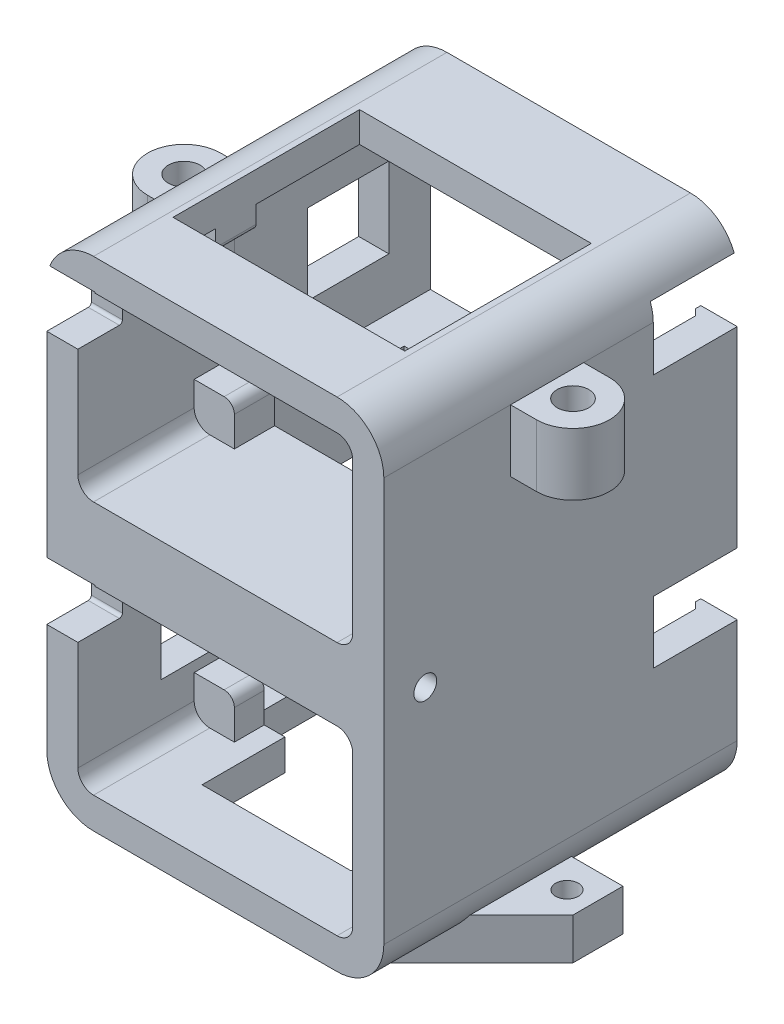
from build123d import *

# Parameters (mm, degrees)
EXTRUDE_2_DEPTH      = 11.22
EXTRUDE_3_DEPTH      = 3.88
CUT_EXTRUDE_1_DEPTH  = 4.65
SKETCH_8_R           = 3.525
SKETCH_8_R_2         = 1.525
EXTRUDE_5_DEPTH      = 6
SKETCH_9_W           = 22.36
SKETCH_9_H           = 3
CUT_EXTRUDE_3_DEPTH  = 8
SKETCH_10_W          = 21.46
SKETCH_10_H          = 6.88
CUT_EXTRUDE_4_DEPTH  = 1
CUT_EXTRUDE_5_DEPTH  = 8
EXTRUDE_7_DEPTH      = 3
SKETCH_15_W          = 26.7
SKETCH_15_H          = 42.2
EXTRUDE_18257_DEPTH  = 19
SKETCH_16_W          = 26.7
SKETCH_16_H          = 6.8
EXTRUDE_9_DEPTH      = 16
EXTRUDE_19749_DEPTH  = 4
CUT_EXTRUDE_8_REACH  = 51.099
SKETCH_17_W          = 19.76
SKETCH_17_H          = 10
CUT_EXTRUDE_9_REACH  = 63.216
SKETCH_18_W          = 8.1
SKETCH_18_H          = 6
CUT_EXTRUDE_START    = -2.91
SKETCH_19_W          = 21.46
SKETCH_19_H          = 1
SKETCH_19_H_2        = 10
CUT_EXTRUDE_10_DEPTH = 2.91
CUT_EXTRUDE_14_REACH = 64.971
SKETCH_24_W          = 14
SKETCH_24_H          = 8
CUT_EXTRUDE_11_REACH = 66.37
SKETCH_20_W          = 22.36
SKETCH_20_H          = 10
SKETCH_21_W          = 1.5
SKETCH_21_H          = 5
EXTRUDE_10_DEPTH     = 0.6
CHAMFER_1_SIZE       = 1
CUT_EXTRUDE_12_REACH = 64.955
SKETCH_22_W          = 15
SKETCH_22_H          = 9.56
SKETCH_22_W_2        = 7.1
SKETCH_22_W_3        = 7.859919518
SKETCH_22_H_2        = 7.76
CUT_EXTRUDE_13_REACH = 64.971
SKETCH_23_W          = 0.38
SKETCH_23_H          = 8


with BuildPart() as part:
    # 草图2 → 凸台-拉伸2 (new body)
    with BuildSketch(Plane.XY):
        with BuildLine():
            ThreePointArc((-16.26, -7.25), (-14.939051583, -10.439051583), (-11.75, -11.76))
            Line((-11.75, -11.76), (11.75, -11.76))
            ThreePointArc((11.75, -11.76), (14.939051583, -10.439051583), (16.26, -7.25))
            Line((16.26, -7.25), (16.26, 31.75))
            ThreePointArc((16.26, 31.75), (14.939051583, 34.939051583), (11.75, 36.26))
            Line((11.75, 36.26), (-11.75, 36.26))
            ThreePointArc((-11.75, 36.26), (-14.939051583, 34.939051583), (-16.26, 31.75))
            Line((-16.26, 31.75), (-16.26, -7.25))
        make_face()
        with BuildLine():
            Line((13.26, 7.25), (13.26, -7.25))
            ThreePointArc((13.26, -7.25), (12.81773124, -8.31773124), (11.75, -8.76))
            Line((11.75, -8.76), (-11.75, -8.76))
            ThreePointArc((-11.75, -8.76), (-12.81773124, -8.31773124), (-13.26, -7.25))
            Line((-13.26, -7.25), (-13.26, 7.25))
            ThreePointArc((-13.26, 7.25), (-12.81773124, 8.31773124), (-11.75, 8.76))
            Line((-11.75, 8.76), (11.75, 8.76))
            ThreePointArc((11.75, 8.76), (12.81773124, 8.31773124), (13.26, 7.25))
        make_face(mode=Mode.SUBTRACT)
        with BuildLine():
            Line((-11.75, 33.26), (11.75, 33.26))
            ThreePointArc((11.75, 33.26), (12.81773124, 32.81773124), (13.26, 31.75))
            Line((13.26, 31.75), (13.26, 17.25))
            ThreePointArc((13.26, 17.25), (12.81773124, 16.18226876), (11.75, 15.74))
            Line((11.75, 15.74), (-11.75, 15.74))
            ThreePointArc((-11.75, 15.74), (-12.81773124, 16.18226876), (-13.26, 17.25))
            Line((-13.26, 17.25), (-13.26, 31.75))
            ThreePointArc((-13.26, 31.75), (-12.81773124, 32.81773124), (-11.75, 33.26))
        make_face(mode=Mode.SUBTRACT)
    extrude(amount=-EXTRUDE_2_DEPTH)

    # 草图3 → 凸台-拉伸3 (add)
    with BuildSketch(Plane(origin=(0, 0, -11.22), x_dir=(-1, 0, 0), z_dir=(0, 0, -1))):
        with BuildLine():
            ThreePointArc((11.75, -11.76), (14.939051583, -10.439051583), (16.26, -7.25))
            Line((16.26, -7.25), (16.26, 31.75))
            ThreePointArc((16.26, 31.75), (14.939051583, 34.939051583), (11.75, 36.26))
            Line((11.75, 36.26), (-11.75, 36.26))
            ThreePointArc((-11.75, 36.26), (-14.939051583, 34.939051583), (-16.26, 31.75))
            Line((-16.26, 31.75), (-16.26, -7.25))
            ThreePointArc((-16.26, -7.25), (-14.939051583, -10.439051583), (-11.75, -11.76))
            Line((-11.75, -11.76), (11.75, -11.76))
        make_face()
        with BuildLine():
            Line((13.26, -4.88), (10.37, -4.88))
            ThreePointArc((10.37, -4.88), (9.669964287, -5.169964287), (9.38, -5.87))
            Line((9.38, -5.87), (9.38, -8.76))
            Line((9.38, -8.76), (-9.38, -8.76))
            Line((-9.38, -8.76), (-9.38, -5.87))
            ThreePointArc((-9.38, -5.87), (-9.669964287, -5.169964287), (-10.37, -4.88))
            Line((-10.37, -4.88), (-13.26, -4.88))
            Line((-13.26, -4.88), (-13.26, 6.68))
            Line((-13.26, 6.68), (-11.67, 6.68))
            ThreePointArc((-11.67, 6.68), (-11.323517677, 6.823517677), (-11.18, 7.17))
            Line((-11.18, 7.17), (-11.18, 8.76))
            Line((-11.18, 8.76), (11.18, 8.76))
            Line((11.18, 8.76), (11.18, 7.17))
            ThreePointArc((11.18, 7.17), (11.323517677, 6.823517677), (11.67, 6.68))
            Line((11.67, 6.68), (13.26, 6.68))
            Line((13.26, 6.68), (13.26, -4.88))
        make_face(mode=Mode.SUBTRACT)
        with BuildLine():
            Line((13.26, 31.18), (13.26, 19.62))
            Line((13.26, 19.62), (10.37, 19.62))
            ThreePointArc((10.37, 19.62), (9.669964287, 19.330035713), (9.38, 18.63))
            Line((9.38, 18.63), (9.38, 15.74))
            Line((9.38, 15.74), (-9.38, 15.74))
            Line((-9.38, 15.74), (-9.38, 18.63))
            ThreePointArc((-9.38, 18.63), (-9.669964287, 19.330035713), (-10.37, 19.62))
            Line((-10.37, 19.62), (-13.26, 19.62))
            Line((-13.26, 19.62), (-13.26, 31.18))
            Line((-13.26, 31.18), (-11.67, 31.18))
            ThreePointArc((-11.67, 31.18), (-11.323517677, 31.323517677), (-11.18, 31.67))
            Line((-11.18, 31.67), (-11.18, 33.26))
            Line((-11.18, 33.26), (11.18, 33.26))
            Line((11.18, 33.26), (11.18, 31.67))
            ThreePointArc((11.18, 31.67), (11.323517677, 31.323517677), (11.67, 31.18))
            Line((11.67, 31.18), (13.26, 31.18))
        make_face(mode=Mode.SUBTRACT)
    extrude(amount=EXTRUDE_3_DEPTH)

    # 草图4 → 切除-拉伸1 (cut)
    with BuildSketch(Plane.ZY.offset(16.26)):
        with BuildLine():
            Line((0.1, 8.85), (-4, 8.85))
            ThreePointArc((-4, 8.85), (-4.212132034, 8.762132034), (-4.3, 8.55))
            Line((-4.3, 8.55), (-4.3, 3.55))
            ThreePointArc((-4.3, 3.55), (-4.212132034, 3.337867966), (-4, 3.25))
            Line((-4, 3.25), (0.1, 3.25))
            Line((0.1, 3.25), (0.1, 8.85))
        make_face()
        with BuildLine():
            Line((0.1, 33.35), (-4, 33.35))
            ThreePointArc((-4, 33.35), (-4.212132034, 33.262132034), (-4.3, 33.05))
            Line((-4.3, 33.05), (-4.3, 28.05))
            ThreePointArc((-4.3, 28.05), (-4.212132034, 27.837867966), (-4, 27.75))
            Line((-4, 27.75), (0.1, 27.75))
            Line((0.1, 27.75), (0.1, 33.35))
        make_face()
    extrude(amount=-CUT_EXTRUDE_1_DEPTH, mode=Mode.SUBTRACT)

    # 草图8 → 凸台-拉伸5 (add)
    # profile 1 of 3: a face of its own
    with BuildSketch(Plane(origin=(0, 31.75, 0), x_dir=(1, 0, 0), z_dir=(0, 1, 0))):
        with Locations((18.76, 15.755)):
            Circle(SKETCH_8_R)
        with Locations(Location((18.76, 15.755, 0), (0, 0, 270))):
            Circle(SKETCH_8_R_2, mode=Mode.SUBTRACT)
    # profile 2 of 3: a face of its own
    with BuildSketch(Plane(origin=(0, 31.75, 0), x_dir=(1, 0, 0), z_dir=(0, 1, 0))):
        with BuildLine():
            Line((15.235, 19.28), (15.235, 15.755))
            ThreePointArc((15.235, 15.755), (16.267448596, 18.247551404), (18.76, 19.28))
            Line((18.76, 19.28), (15.235, 19.28))
        make_face()
    # profile 3 of 3: a face of its own
    with BuildSketch(Plane(origin=(0, 31.75, 0), x_dir=(1, 0, 0), z_dir=(0, 1, 0))):
        with BuildLine():
            Line((15.235, 12.23), (18.76, 12.23))
            ThreePointArc((18.76, 12.23), (16.267448596, 13.262448596), (15.235, 15.755))
            Line((15.235, 15.755), (15.235, 12.23))
        make_face()
    extrude_5 = extrude(amount=-EXTRUDE_5_DEPTH)

    # 镜向1: 凸台-拉伸5 across plane
    add(extrude_5.mirror(Plane(origin=(0, 0, 0), x_dir=(0, 0, 1), z_dir=(1, 0, 0))))

    # 草图9 → 切除-拉伸3 (cut)
    with BuildSketch(Plane(origin=(0, 0, -15.1), x_dir=(-1, 0, 0), z_dir=(0, 0, -1))):
        with Locations((0, 34.76)):
            Rectangle(SKETCH_9_W, SKETCH_9_H)
    extrude(amount=-CUT_EXTRUDE_3_DEPTH, mode=Mode.SUBTRACT)

    # 草图10 → 切除-拉伸4 (cut)
    with BuildSketch(Plane(origin=(0, 0, -15.1), x_dir=(-1, 0, 0), z_dir=(0, 0, -1))):
        with Locations((0, -8.32)):
            Rectangle(SKETCH_10_W, SKETCH_10_H)
    extrude(amount=-CUT_EXTRUDE_4_DEPTH, mode=Mode.SUBTRACT)

    # 草图12 → 切除-拉伸5 (cut)
    with BuildSketch(Plane.ZY.offset(16.26)):
        with BuildLine():
            ThreePointArc((-2.9, 12.25), (-4, 13.35), (-5.1, 12.25))
            Line((-5.1, 12.25), (-2.9, 12.25))
        make_face()
        with BuildLine():
            Line((-2.9, 12.25), (-5.1, 12.25))
            ThreePointArc((-5.1, 12.25), (-4, 11.15), (-2.9, 12.25))
        make_face()
    cut_extrude_5 = extrude(amount=-CUT_EXTRUDE_5_DEPTH, mode=Mode.SUBTRACT)

    # 镜向2: 切除-拉伸5 across plane
    add(cut_extrude_5.mirror(Plane(origin=(0, 0, 0), x_dir=(0, 0, 1), z_dir=(1, 0, 0))), mode=Mode.SUBTRACT)

    # 草图14 → 凸台-拉伸7 (add)
    with BuildSketch(Plane(origin=(0, 0, -15.1), x_dir=(-1, 0, 0), z_dir=(0, 0, -1))):
        with BuildLine():
            Line((-16.26, 19.53), (-16.26, 8.85))
            Line((-16.26, 8.85), (-9.88, 8.85))
            Line((-9.88, 8.85), (-9.88, 19.490232527))
            ThreePointArc((-9.88, 19.490232527), (-9.918346198, 19.510970398), (-9.957568187, 19.53))
            Line((-9.957568187, 19.53), (-16.26, 19.53))
        make_face()
        with BuildLine():
            Line((9.88, 8.85), (16.26, 8.85))
            Line((16.26, 8.85), (16.26, 19.53))
            Line((16.26, 19.53), (9.957568187, 19.53))
            ThreePointArc((9.957568187, 19.53), (9.918346198, 19.510970398), (9.88, 19.490232527))
            Line((9.88, 19.490232527), (9.88, 8.85))
        make_face()
    extrude(amount=EXTRUDE_7_DEPTH)

    # 草图15 → Extrude 18257 (add)
    with BuildSketch(Plane(origin=(0, 0, -15.1), x_dir=(-1, 0, 0), z_dir=(0, 0, -1))):
        with BuildLine():
            Line((-16.26, 31.75), (-16.26, 19.53))
            Line((-16.26, 19.53), (-16.26, 8.85))
            Line((-16.26, 8.85), (-16.26, -7.25))
            ThreePointArc((-16.26, -7.25), (-14.939051583, -10.439051583), (-11.75, -11.76))
            Line((-11.75, -11.76), (11.75, -11.76))
            ThreePointArc((11.75, -11.76), (14.939051583, -10.439051583), (16.26, -7.25))
            Line((16.26, -7.25), (16.26, 8.85))
            Line((16.26, 8.85), (16.26, 19.53))
            Line((16.26, 19.53), (16.26, 31.75))
            ThreePointArc((16.26, 31.75), (14.939051583, 34.939051583), (11.75, 36.26))
            Line((11.75, 36.26), (-11.75, 36.26))
            ThreePointArc((-11.75, 36.26), (-14.939051583, 34.939051583), (-16.26, 31.75))
        make_face()
        with Locations((0, 12.25)):
            Rectangle(SKETCH_15_W, SKETCH_15_H, mode=Mode.SUBTRACT)
    extrude(amount=EXTRUDE_18257_DEPTH)

    # 草图16 → 凸台-拉伸9 (add)
    with BuildSketch(Plane(origin=(0, 0, -18.1), x_dir=(-1, 0, 0), z_dir=(0, 0, -1))):
        with Locations((0, 12.25)):
            Rectangle(SKETCH_16_W, SKETCH_16_H)
    extrude(amount=EXTRUDE_9_DEPTH)

    # 草图11 → Extrude 19749 (add)
    with BuildSketch(Plane(origin=(0, -13.58, 0), x_dir=(1, 0, 0), z_dir=(0, 1, 0))):
        with BuildLine():
            Line((15.88, 18.755), (11.75, 18.755))
            Line((11.75, 18.755), (11.75, 5.082359313))
            Line((11.75, 5.082359313), (16.522640687, 9.855))
            Line((16.522640687, 9.855), (15.88, 9.855))
            Line((15.88, 9.855), (15.88, 15.105))
            Line((15.88, 15.105), (17.292588033, 15.105))
            ThreePointArc((17.292588033, 15.105), (17.08, 15.755), (17.292588033, 16.405))
            Line((17.292588033, 16.405), (15.88, 16.405))
            Line((15.88, 16.405), (15.88, 18.755))
        make_face()
        with BuildLine():
            Line((20.58, 18.755), (15.88, 18.755))
            Line((15.88, 18.755), (15.88, 16.405))
            Line((15.88, 16.405), (17.292588033, 16.405))
            ThreePointArc((17.292588033, 16.405), (18.521940664, 16.800503028), (19.28, 15.755))
            ThreePointArc((19.28, 15.755), (18.521940664, 14.709496972), (17.292588033, 15.105))
            Line((17.292588033, 15.105), (15.88, 15.105))
            Line((15.88, 15.105), (15.88, 9.855))
            Line((15.88, 9.855), (16.522640687, 9.855))
            Line((16.522640687, 9.855), (20.58, 13.912359313))
            Line((20.58, 13.912359313), (20.58, 18.755))
        make_face()
    extrude(amount=EXTRUDE_19749_DEPTH)

    # 草图17 → 切除-拉伸8 (cut, up to next)
    with BuildSketch(Plane.XZ.offset(-8.85), mode=Mode.PRIVATE) as cut_extrude_8_sk1:
        with Locations((0, -23.1)):
            Rectangle(SKETCH_17_W, SKETCH_17_H)
    cut_extrude_8_tool1 = extrude(cut_extrude_8_sk1.sketch, amount=-CUT_EXTRUDE_8_REACH, mode=Mode.PRIVATE) & part.part
    add(cut_extrude_8_tool1.solids().sort_by_distance((0, 8.85, -23.1))[0], mode=Mode.SUBTRACT)

    # 草图18 → 切除-拉伸9 (cut, up to next)
    with BuildSketch(Plane.ZY.offset(-13.35), mode=Mode.PRIVATE) as cut_extrude_9_sk1:
        with Locations((-30.05, 5.85)):
            Rectangle(SKETCH_18_W, SKETCH_18_H)
    cut_extrude_9_tool1 = extrude(cut_extrude_9_sk1.sketch, amount=-CUT_EXTRUDE_9_REACH, mode=Mode.PRIVATE) & part.part
    # 草图18 → 切除-拉伸9 (cut, up to next)
    with BuildSketch(Plane.ZY.offset(-13.35), mode=Mode.PRIVATE) as cut_extrude_9_sk2:
        with Locations((-30.05, 30.35)):
            Rectangle(SKETCH_18_W, SKETCH_18_H)
    cut_extrude_9_tool2 = extrude(cut_extrude_9_sk2.sketch, amount=-CUT_EXTRUDE_9_REACH, mode=Mode.PRIVATE) & part.part
    add(cut_extrude_9_tool1.solids().sort_by_distance((13.35, 5.85, -30.05))[0], mode=Mode.SUBTRACT)
    add(cut_extrude_9_tool2.solids().sort_by_distance((13.35, 30.35, -30.05))[0], mode=Mode.SUBTRACT)

    # 草图19 → 切除-拉伸10 (cut)
    with BuildSketch(Plane.XZ.offset(11.76).offset(CUT_EXTRUDE_START)):
        with Locations((0, -14.6)):
            Rectangle(SKETCH_19_W, SKETCH_19_H)
        with Locations((0, -20.1)):
            Rectangle(SKETCH_19_W, SKETCH_19_H_2)
    extrude(amount=CUT_EXTRUDE_10_DEPTH, mode=Mode.SUBTRACT)

    # 草图24 → 切除-拉伸14 (cut, up to next)
    with BuildSketch(Plane.XZ.offset(11.76), mode=Mode.PRIVATE) as cut_extrude_14_sk1:
        with Locations((0, -10.1)):
            Rectangle(SKETCH_24_W, SKETCH_24_H)
    cut_extrude_14_tool1 = extrude(cut_extrude_14_sk1.sketch, amount=-CUT_EXTRUDE_14_REACH, mode=Mode.PRIVATE) & part.part
    add(cut_extrude_14_tool1.solids().sort_by_distance((0, -11.76, -10.1))[0], mode=Mode.SUBTRACT)

    # 草图20 → 切除-拉伸11 (cut, up to next)
    with BuildSketch(Plane(origin=(0, 36.26, 0), x_dir=(1, 0, 0), z_dir=(0, 1, 0)), mode=Mode.PRIVATE) as cut_extrude_11_sk1:
        with Locations((0, 20.1)):
            Rectangle(SKETCH_20_W, SKETCH_20_H)
    cut_extrude_11_tool1 = extrude(cut_extrude_11_sk1.sketch, amount=-CUT_EXTRUDE_11_REACH, mode=Mode.PRIVATE) & part.part
    add(cut_extrude_11_tool1.solids().sort_by_distance((0, 36.26, -20.1))[0], mode=Mode.SUBTRACT)

    # 草图21 → 凸台-拉伸10 (add)
    with BuildSketch(Plane.ZY.offset(-13.35)):
        with Locations((-33.35, 24.85)):
            Rectangle(SKETCH_21_W, SKETCH_21_H)
        with Locations((-33.35, 0.35)):
            Rectangle(SKETCH_21_W, SKETCH_21_H)
    extrude(amount=EXTRUDE_10_DEPTH)

    # 倒角1
    # the kernel refuses this chamfer: 1 mm, written as the material it takes off along each edge
    with BuildSketch(Plane(origin=(12.75, 5.421682988, -32.6), x_dir=(-0.02749587661058555, 0, -0.9996219169112968), z_dir=(0, -1, 0))) as chamfer_1_piece_1_section:
        Polygon((CHAMFER_1_SIZE * 0.999621916911, CHAMFER_1_SIZE * 0.0274958766106), (-CHAMFER_1_SIZE * 0.0274958766106, CHAMFER_1_SIZE * 0.999621916911), (0, 0), align=None)
    chamfer_1_piece_1 = extrude(amount=10.143365976, mode=Mode.PRIVATE)
    chamfer_1_piece_1 = split(chamfer_1_piece_1, bisect_by=Plane(origin=(13.35, 0.35, -32.97500946), z_dir=(-1, 0, 0)), keep=Keep.TOP, mode=Mode.PRIVATE)
    add(chamfer_1_piece_1, mode=Mode.SUBTRACT)
    with BuildSketch(Plane(origin=(12.75, 29.921682988, -32.6), x_dir=(-0.02749587661058555, 0, -0.9996219169112968), z_dir=(0, -1, 0))) as chamfer_1_piece_2_section:
        Polygon((CHAMFER_1_SIZE * 0.999621916911, CHAMFER_1_SIZE * 0.0274958766106), (-CHAMFER_1_SIZE * 0.0274958766106, CHAMFER_1_SIZE * 0.999621916911), (0, 0), align=None)
    chamfer_1_piece_2 = extrude(amount=10.143365976, mode=Mode.PRIVATE)
    chamfer_1_piece_2 = split(chamfer_1_piece_2, bisect_by=Plane(origin=(13.35, 24.85, -32.97500946), z_dir=(-1, 0, 0)), keep=Keep.TOP, mode=Mode.PRIVATE)
    add(chamfer_1_piece_2, mode=Mode.SUBTRACT)

    # 草图22 → 切除-拉伸12 (cut, up to next)
    with BuildSketch(Plane.ZY.offset(16.26), mode=Mode.PRIVATE) as cut_extrude_12_sk1:
        with Locations((-22.6, 0.9)):
            Rectangle(SKETCH_22_W, SKETCH_22_H)
    cut_extrude_12_tool1 = extrude(cut_extrude_12_sk1.sketch, amount=-CUT_EXTRUDE_12_REACH, mode=Mode.PRIVATE) & part.part
    # 草图22 → 切除-拉伸12 (cut, up to next)
    with BuildSketch(Plane.ZY.offset(16.26), mode=Mode.PRIVATE) as cut_extrude_12_sk2:
        with Locations((-11.55, 0.9)):
            Rectangle(SKETCH_22_W_2, SKETCH_22_H)
    cut_extrude_12_tool2 = extrude(cut_extrude_12_sk2.sketch, amount=-CUT_EXTRUDE_12_REACH, mode=Mode.PRIVATE) & part.part
    # 草图22 → 切除-拉伸12 (cut, up to next)
    with BuildSketch(Plane.ZY.offset(16.26), mode=Mode.PRIVATE) as cut_extrude_12_sk3:
        with Locations((-26.170040241, 24.5)):
            Rectangle(SKETCH_22_W_3, SKETCH_22_H_2)
    cut_extrude_12_tool3 = extrude(cut_extrude_12_sk3.sketch, amount=-CUT_EXTRUDE_12_REACH, mode=Mode.PRIVATE) & part.part
    add(cut_extrude_12_tool1.solids().sort_by_distance((-16.26, 0.9, -22.6))[0], mode=Mode.SUBTRACT)
    add(cut_extrude_12_tool2.solids().sort_by_distance((-16.26, 0.9, -11.55))[0], mode=Mode.SUBTRACT)
    add(cut_extrude_12_tool3.solids().sort_by_distance((-16.26, 24.5, -26.17004))[0], mode=Mode.SUBTRACT)

    # 草图23 → 切除-拉伸13 (cut, up to next)
    with BuildSketch(Plane.XZ.offset(11.76), mode=Mode.PRIVATE) as cut_extrude_13_sk1:
        with Locations((-7.19, -10.1)):
            Rectangle(SKETCH_23_W, SKETCH_23_H)
    cut_extrude_13_tool1 = extrude(cut_extrude_13_sk1.sketch, amount=-CUT_EXTRUDE_13_REACH, mode=Mode.PRIVATE) & part.part
    add(cut_extrude_13_tool1.solids().sort_by_distance((-7.19, -11.76, -10.1))[0], mode=Mode.SUBTRACT)


solid = part.part
